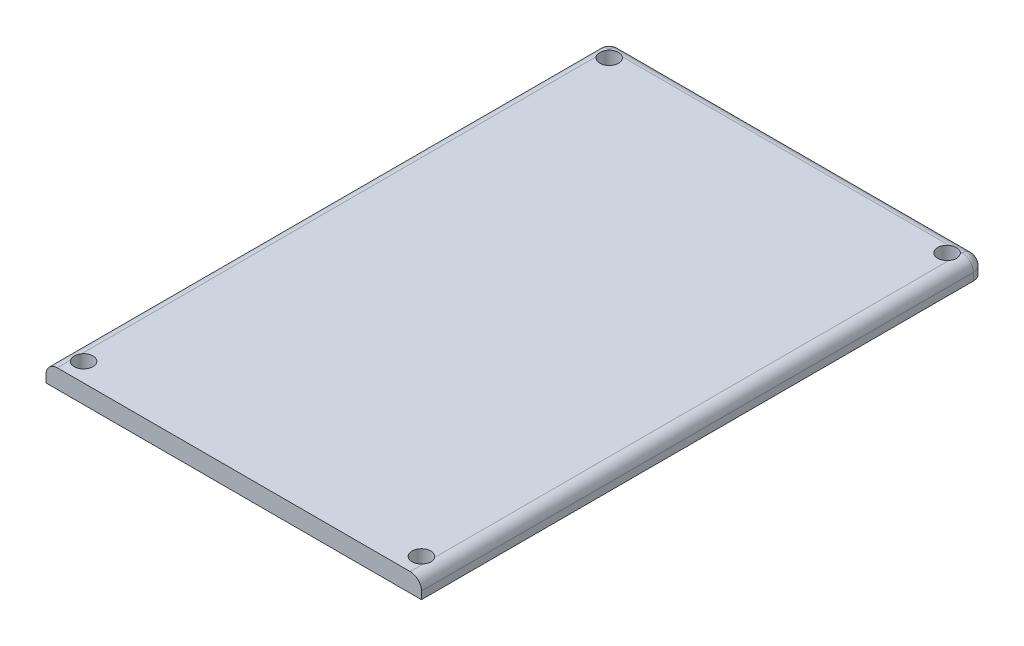
from build123d import *

# Parameters (mm, degrees)
SKETCH1_W           = 100
SKETCH1_H           = 150
BOSS_EXTRUDE1_DEPTH = 5
SKETCH2_R           = 2.5
CUT_EXTRUDE1_DEPTH  = 91.277350426
FILLET1_R           = 3


with BuildPart() as part:
    # Sketch1 → Boss-Extrude1 (new body)
    with BuildSketch(Plane(origin=(0, 0, 0), x_dir=(1, 0, 0), z_dir=(0, 1, 0))):
        Rectangle(SKETCH1_W, SKETCH1_H)
    extrude(amount=BOSS_EXTRUDE1_DEPTH)

    # Sketch2 → Cut-Extrude1 (cut, through all)
    with BuildSketch(Plane(origin=(0, 5, 0), x_dir=(1, 0, 0), z_dir=(0, 1, 0))):
        with Locations(Location((-45, 70, 0), (0, 0, 270))):
            Circle(SKETCH2_R)
        with Locations(Location((45, 70, 0), (0, 0, 90))):
            Circle(SKETCH2_R)
        with Locations(Location((45, -70, 0), (0, 0, 270))):
            Circle(SKETCH2_R)
        with Locations(Location((-45, -70, 0), (0, 0, 90))):
            Circle(SKETCH2_R)
    extrude(amount=-CUT_EXTRUDE1_DEPTH, mode=Mode.SUBTRACT)

    # Fillet1
    # the kernel refuses this fillet: 3 mm, written as the material it takes off along each edge
    with BuildSketch(Plane(origin=(-47, 2, -72), x_dir=(-1, 0, 0), z_dir=(0, 0, -1))) as fillet1_piece_1_section:
        Polygon((0, 0), (FILLET1_R, 0), (FILLET1_R, FILLET1_R), (0, FILLET1_R), align=None)
    fillet1_piece_1 = extrude(amount=FILLET1_R, mode=Mode.PRIVATE)
    fillet1_piece_1 = fillet1_piece_1 - Plane(origin=(-47, 2, -72), x_dir=(0.7071067811865475, -0.7071067811865475, 0), z_dir=(0, 0, -1)) * Sphere(FILLET1_R, mode=Mode.PRIVATE)
    add(fillet1_piece_1, mode=Mode.SUBTRACT)
    with BuildSketch(Plane(origin=(47, 2, -72), x_dir=(1, 0, 0), z_dir=(0, 0, -1))) as fillet1_piece_2_section:
        Polygon((0, 0), (FILLET1_R, 0), (FILLET1_R, -FILLET1_R), (0, -FILLET1_R), align=None)
    fillet1_piece_2 = extrude(amount=FILLET1_R, mode=Mode.PRIVATE)
    fillet1_piece_2 = fillet1_piece_2 - Plane(origin=(47, 2, -72), x_dir=(-0.7071067811865475, -0.7071067811865475, 0), z_dir=(0, 0, -1)) * Sphere(FILLET1_R, mode=Mode.PRIVATE)
    add(fillet1_piece_2, mode=Mode.SUBTRACT)
    with BuildSketch(Plane(origin=(-50, 5, 82.5), x_dir=(0, -1, 0), z_dir=(0, 0, -1)), Plane(origin=(50, 5, -72), x_dir=(0, -1, 0), z_dir=(0, 0, 1))) as fillet1_piece_3:
        with BuildLine():
            CenterArc((FILLET1_R, -FILLET1_R), FILLET1_R, 90, 90)
            Line((0, -FILLET1_R), (0, 0))
            Line((0, 0), (FILLET1_R, 0))
        make_face()
    extrude(amount=154.5, mode=Mode.SUBTRACT)
    with BuildSketch(Plane(origin=(-50, -7.5, -75), x_dir=(1, 0, 0), z_dir=(0, 1, 0))) as fillet1_piece_4:
        with BuildLine():
            CenterArc((FILLET1_R, -FILLET1_R), FILLET1_R, 90, 90)
            Line((0, -FILLET1_R), (0, 0))
            Line((0, 0), (FILLET1_R, 0))
        make_face()
    extrude(amount=9.5, mode=Mode.SUBTRACT)
    with BuildSketch(Plane(origin=(50, -7.5, -75), x_dir=(-1, 0, 0), z_dir=(0, 1, 0))) as fillet1_piece_5:
        with BuildLine():
            CenterArc((FILLET1_R, FILLET1_R), FILLET1_R, 180, 90)
            Line((0, FILLET1_R), (0, 0))
            Line((0, 0), (FILLET1_R, 0))
        make_face()
    extrude(amount=9.5, mode=Mode.SUBTRACT)
    with BuildSketch(Plane(origin=(-47, 5, -75), x_dir=(0, -1, 0), z_dir=(1, 0, 0))) as fillet1_piece_6:
        with BuildLine():
            CenterArc((FILLET1_R, -FILLET1_R), FILLET1_R, 90, 90)
            Line((0, -FILLET1_R), (0, 0))
            Line((0, 0), (FILLET1_R, 0))
        make_face()
    extrude(amount=94, mode=Mode.SUBTRACT)


solid = part.part
